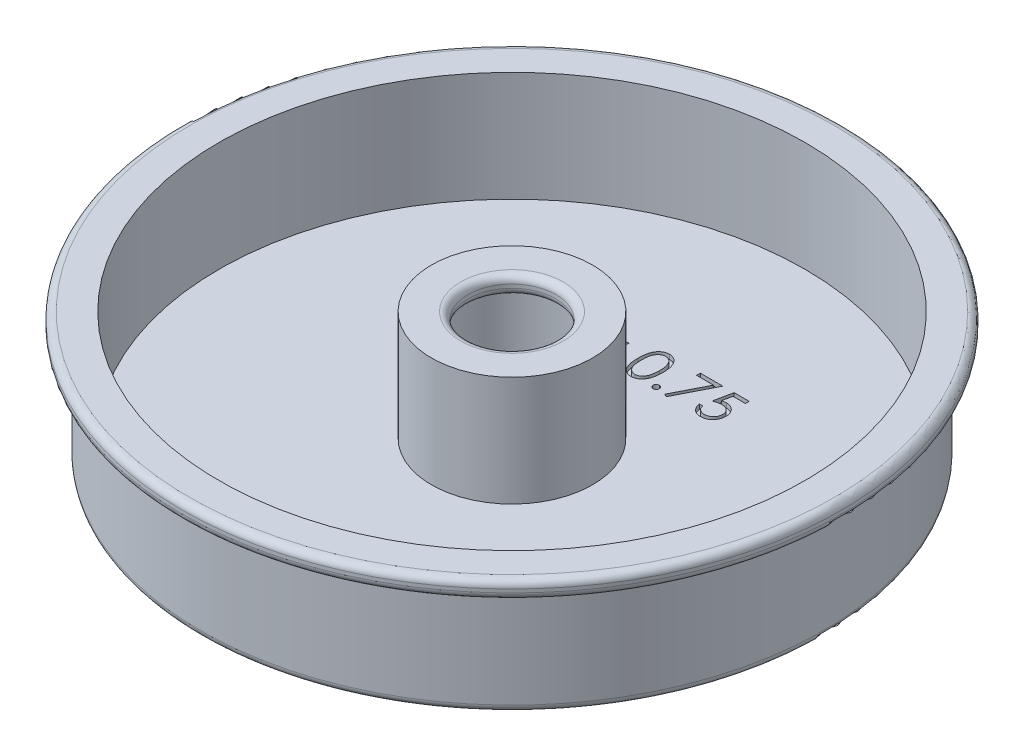
from build123d import *

# Parameters (mm, degrees)
CUT_EXTRUDE1_DEPTH = 0.79375


with BuildPart() as part:
    # Sketch1 → Revolve2 (revolve)
    with BuildSketch(Plane.XY):
        with BuildLine():
            Line((13.97, -3.138174804), (13.97, 15.911825196))
            Line((13.97, 15.911825196), (8.89, 15.911825196))
            ThreePointArc((8.89, 15.911825196), (7.991974388, 15.539850808), (7.62, 14.641825196))
            Line((7.62, 14.641825196), (7.62, 14.006825196))
            ThreePointArc((7.62, 14.006825196), (7.991974388, 13.108799584), (8.89, 12.736825196))
            Line((8.89, 12.736825196), (9.525, 12.736825196))
            ThreePointArc((9.525, 12.736825196), (10.423025612, 12.364850808), (10.795, 11.466825196))
            Line((10.795, 11.466825196), (10.795, -5.043174804))
            ThreePointArc((10.795, -5.043174804), (11.166974388, -5.941200416), (12.065, -6.313174804))
            Line((12.065, -6.313174804), (52.705, -6.313174804))
            ThreePointArc((52.705, -6.313174804), (53.603025612, -5.941200416), (53.975, -5.043174804))
            Line((53.975, -5.043174804), (53.975, 11.503650391))
            ThreePointArc((53.975, 11.503650391), (54.346974388, 12.401676004), (55.245, 12.773650391))
            Line((55.245, 12.773650391), (55.88, 12.773650391))
            ThreePointArc((55.88, 12.773650391), (56.778025612, 13.145624779), (57.15, 14.043650391))
            Line((57.15, 14.043650391), (57.15, 14.641825196))
            ThreePointArc((57.15, 14.641825196), (56.778025612, 15.539850808), (55.88, 15.911825196))
            Line((55.88, 15.911825196), (50.8, 15.911825196))
            Line((50.8, 15.911825196), (50.8, -3.138174804))
            Line((50.8, -3.138174804), (13.97, -3.138174804))
        make_face()
    revolve(axis=Axis((0, 0, 0), (0, 1, 0)))

    # Sketch2 → Cut-Extrude1 (cut)
    # profile 1 of 6: a face of its own
    with BuildSketch(Plane(origin=(0, -3.138174804, 0), x_dir=(1, 0, 0), z_dir=(0, 1, 0))):
        Polygon((-11.649486072, 26.284716058), (-11.533730864, 26.284716058), (-11.533730864, 21.888562212), (-10.801038556, 21.888562212), (-10.801038556, 21.23728016), (-11.533730864, 21.23728016), (-11.533730864, 19.771895545), (-12.103602659, 19.771895545), (-12.103602659, 21.23728016), (-15.115782146, 21.23728016), align=None)
        Polygon((-12.103602659, 21.888562212), (-12.103602659, 24.646334648), (-13.99639112, 21.888562212), align=None, mode=Mode.SUBTRACT)
    # profile 2 of 6: a face of its own
    with BuildSketch(Plane(origin=(0, -3.138174804, 0), x_dir=(1, 0, 0), z_dir=(0, 1, 0))):
        Polygon((-7.788859069, 24.41228016), (-7.110864277, 24.41228016), (-5.916423172, 22.738281763), (-4.721982066, 24.41228016), (-4.043987274, 24.41228016), (-5.576789758, 22.263812612), (-3.799756505, 19.771895545), (-4.477751297, 19.771895545), (-5.916423172, 21.788071426), (-7.355095047, 19.771895545), (-8.033089838, 19.771895545), (-6.25478455, 22.263812612), align=None)
    # profile 3 of 6: a face of its own
    with BuildSketch(Plane(origin=(0, -3.138174804, 0), x_dir=(1, 0, 0), z_dir=(0, 1, 0))):
        with BuildLine():
            add(Edge.make_bspline(
                [(-1.113218043, 22.944351475), (-1.112622925, 23.046128164), (-1.111466898, 23.243830849), (-1.098606477, 23.531911557), (-1.077242642, 23.802168081), (-1.047964837, 24.054613358), (-1.01233593, 24.28931256), (-0.964773547, 24.505638476), (-0.910684605, 24.704592334), (-0.847996596, 24.886822908), (-0.777261608, 25.054785312), (-0.700273735, 25.21158532), (-0.613977608, 25.356985683), (-0.523305209, 25.493307103), (-0.424586164, 25.618318092), (-0.320629787, 25.733784065), (-0.207378669, 25.837036427), (-0.08868264, 25.931100432), (0.036532946, 26.01355876), (0.164698926, 26.086189585), (0.296697475, 26.148237916), (0.432888978, 26.19702485), (0.572049333, 26.237321672), (0.714665011, 26.264878762), (0.860971486, 26.282217725), (0.95972566, 26.283875379), (1.0098088, 26.284716058)],
                knots=[0, 0, 0, 0, 1.646270934, 3.197905019, 4.663502075, 6.030701355, 7.308322542, 8.50163776, 9.611534131, 10.641858119, 11.616356847, 12.558055219, 13.465016945, 14.349605745, 15.204443733, 16.039544428, 16.859896111, 17.680448484, 18.487036065, 19.28249412, 20.06191084, 20.843045899, 21.620316918, 22.403196591, 23.190181807, 24, 24, 24, 24], degree=3))
            add(Edge.make_bspline(
                [(1.0098088, 26.284716058), (1.06031031, 26.283831022), (1.160741927, 26.282070963), (1.30922375, 26.265154668), (1.454275316, 26.23708563), (1.595278224, 26.197314719), (1.7333907, 26.147973991), (1.867532468, 26.086130222), (1.998536745, 26.01414142), (2.124321695, 25.929552385), (2.246268211, 25.835241684), (2.361380944, 25.728629413), (2.469670371, 25.610792066), (2.572495568, 25.482990398), (2.666939295, 25.342773173), (2.756879665, 25.192579145), (2.837383216, 25.029781719), (2.914916126, 24.857097156), (2.981839659, 24.669747375), (3.042194133, 24.468788452), (3.090960262, 24.251846713), (3.131580798, 24.020060382), (3.163049395, 23.772578234), (3.185968617, 23.509930776), (3.1980755, 23.23194521), (3.200355515, 23.041884541), (3.201525546, 22.944351475)],
                knots=[0, 0, 0, 0, 0.810914788, 1.612654377, 2.396697861, 3.181598691, 3.963628158, 4.749916497, 5.551656086, 6.361998678, 7.18212741, 8.025565596, 8.878627764, 9.750805457, 10.657531673, 11.591944965, 12.560506719, 13.57287815, 14.630710178, 15.753379473, 16.941251878, 18.199788006, 19.531962791, 20.947069417, 22.433333509, 24, 24, 24, 24], degree=3))
            add(Edge.make_bspline(
                [(3.201525546, 22.944351475), (3.200343386, 22.847243813), (3.198039994, 22.658033495), (3.18610434, 22.381298725), (3.162593681, 22.120045132), (3.133184131, 21.87364615), (3.092451669, 21.643127328), (3.042368011, 21.427690971), (2.986759568, 21.226406727), (2.918116441, 21.040923569), (2.842985581, 20.868654014), (2.761242582, 20.707786474), (2.673667327, 20.556899057), (2.578256318, 20.417199516), (2.476559411, 20.287698238), (2.366399994, 20.170681123), (2.250883361, 20.063328618), (2.128577978, 19.967803523), (2.000831307, 19.88419252), (1.870276981, 19.80941882), (1.734598557, 19.749125216), (1.596870772, 19.697354499), (1.455123593, 19.65780225), (1.309533713, 19.63045397), (1.160841685, 19.611273616), (1.060327417, 19.609810431), (1.0098088, 19.609075032)],
                knots=[0, 0, 0, 0, 1.561518951, 3.042555995, 4.452378317, 5.7783523, 7.031515105, 8.214008947, 9.334062868, 10.386615937, 11.391082383, 12.354592575, 13.286541444, 14.194233754, 15.072674879, 15.931287219, 16.775624067, 17.606195743, 18.42308326, 19.229000347, 20.022332153, 20.807536673, 21.593273796, 22.3848459, 23.188221202, 24, 24, 24, 24], degree=3))
            add(Edge.make_bspline(
                [(1.0098088, 19.609075032), (0.95972705, 19.609921134), (0.860975615, 19.611589482), (0.714649072, 19.628850109), (0.572622353, 19.656600522), (0.434194613, 19.695456361), (0.29865565, 19.743017564), (0.167852387, 19.804982105), (0.040330447, 19.876345344), (-0.083569948, 19.957617037), (-0.201520583, 20.050729234), (-0.314185195, 20.153715872), (-0.418733444, 20.269146918), (-0.516041018, 20.395199721), (-0.608522578, 20.530714604), (-0.693593298, 20.677541795), (-0.772280419, 20.835099103), (-0.844205037, 21.004404455), (-0.907974756, 21.187928395), (-0.964304169, 21.387770476), (-1.008779854, 21.605694559), (-1.046848931, 21.839950354), (-1.077554597, 22.091544484), (-1.098517444, 22.360613539), (-1.11147383, 22.646989847), (-1.112626029, 22.843422152), (-1.113218043, 22.944351475)],
                knots=[0, 0, 0, 0, 0.810891512, 1.598919785, 2.382837074, 3.152667961, 3.926044502, 4.706494248, 5.493654104, 6.291793342, 7.103789334, 7.925228297, 8.761435821, 9.622817696, 10.50288917, 11.416980706, 12.369136599, 13.353924996, 14.394355917, 15.514179734, 16.714354668, 17.994756427, 19.357759367, 20.818452758, 22.365282078, 24, 24, 24, 24], degree=3))
        make_face()
        with BuildLine():
            add(Edge.make_bspline(
                [(-0.543346249, 22.946895545), (-0.543129537, 22.862080049), (-0.542708944, 22.697469825), (-0.531721266, 22.45826848), (-0.516752988, 22.235165169), (-0.497446634, 22.02787661), (-0.46877557, 21.837104444), (-0.436650398, 21.661536591), (-0.397556007, 21.502102175), (-0.35130076, 21.357707147), (-0.298615542, 21.22590098), (-0.241092046, 21.103253061), (-0.179296163, 20.988314547), (-0.110137133, 20.882117858), (-0.034816947, 20.784316675), (0.044963109, 20.693179965), (0.132180512, 20.611905441), (0.252837302, 20.514429576), (0.412125191, 20.413702005), (0.612822303, 20.325988384), (0.81904935, 20.270865928), (0.959023761, 20.26385597), (1.028889328, 20.260357084)],
                knots=[0, 0, 0, 0, 1.459021318, 2.831673884, 4.118529203, 5.306027144, 6.411944654, 7.436330062, 8.375795394, 9.233974572, 10.042671642, 10.816086306, 11.563610507, 12.285937304, 12.993564865, 13.685989202, 14.367179055, 15.041617293, 16.353048772, 17.594441528, 18.799311195, 20, 20, 20, 20], degree=3))
            add(Edge.make_bspline(
                [(1.028889328, 20.260357084), (1.099206818, 20.263255914), (1.239696619, 20.269047591), (1.444953647, 20.3249253), (1.644217137, 20.409234322), (1.800376229, 20.508924796), (1.919180272, 20.603863337), (2.004301097, 20.684807056), (2.082427956, 20.775441272), (2.156527149, 20.873229995), (2.224488615, 20.980041502), (2.286288879, 21.095362174), (2.342682953, 21.219512254), (2.374812222, 21.306180209), (2.391239088, 21.350491298)],
                knots=[0, 0, 0, 0, 1.353760809, 2.704726607, 4.075137775, 5.516104923, 6.260822281, 7.007110065, 7.778089737, 8.566572457, 9.372053459, 10.217411131, 11.088608312, 12, 12, 12, 12], degree=3))
            add(Edge.make_bspline(
                [(2.391239088, 21.350491298), (2.41038301, 21.407150968), (2.44925338, 21.522194398), (2.499349028, 21.700654167), (2.538801395, 21.887893467), (2.57429493, 22.082793322), (2.598521189, 22.286791065), (2.618020793, 22.499255504), (2.629506468, 22.720346833), (2.63093023, 22.870560603), (2.631653751, 22.946895545)],
                knots=[0, 0, 0, 0, 0.884706709, 1.796334032, 2.740027952, 3.714592787, 4.726048262, 5.777819803, 6.87074269, 8, 8, 8, 8], degree=3))
            add(Edge.make_bspline(
                [(2.631653751, 22.946895545), (2.630655551, 23.023218141), (2.628702857, 23.172521454), (2.621238908, 23.391175868), (2.601964709, 23.598853091), (2.580557736, 23.796447806), (2.548994206, 23.982866212), (2.514962185, 24.159668909), (2.469239986, 24.324665539), (2.420399823, 24.480439352), (2.364500962, 24.625220539), (2.30296813, 24.759684123), (2.237251511, 24.884479267), (2.165873446, 24.999263575), (2.089681278, 25.104551189), (2.00666401, 25.198231096), (1.920114648, 25.283206738), (1.798889182, 25.380203113), (1.640185828, 25.479102904), (1.442708725, 25.570117925), (1.237203413, 25.622384399), (1.098277289, 25.62975346), (1.028889328, 25.633434007)],
                knots=[0, 0, 0, 0, 1.31362396, 2.569729283, 3.763502607, 4.902122613, 5.988968491, 7.01645872, 7.998833611, 8.933434873, 9.825090667, 10.667526885, 11.477055099, 12.250526234, 12.991942729, 13.710640831, 14.402115721, 15.076753259, 16.378508321, 17.609869233, 18.806226677, 20, 20, 20, 20], degree=3))
            add(Edge.make_bspline(
                [(1.028889328, 25.633434007), (0.958657254, 25.629748382), (0.81806516, 25.622370418), (0.61042387, 25.570312658), (0.411388832, 25.479574849), (0.25310515, 25.379875544), (0.131795137, 25.284918894), (0.046373679, 25.202574898), (-0.03372009, 25.112502408), (-0.107502918, 25.013801791), (-0.17660776, 24.907728911), (-0.240073312, 24.793449295), (-0.297254753, 24.67038382), (-0.350022411, 24.538636858), (-0.396418755, 24.394254288), (-0.434689231, 24.235016256), (-0.470044313, 24.060006824), (-0.495072873, 23.868201431), (-0.517322829, 23.660860953), (-0.531621846, 23.437200675), (-0.542745699, 23.197598157), (-0.543142056, 23.032136826), (-0.543346249, 22.946895545)],
                knots=[0, 0, 0, 0, 1.207732386, 2.417664972, 3.655092373, 4.956220595, 5.625982001, 6.301752483, 6.994047911, 7.697131622, 8.419323945, 9.170223765, 9.943494443, 10.752040957, 11.610060368, 12.549350801, 13.567764191, 14.679664412, 15.874934091, 17.154273443, 18.533957287, 20, 20, 20, 20], degree=3))
        make_face(mode=Mode.SUBTRACT)
    # profile 4 of 6: a face of its own
    with BuildSketch(Plane(origin=(0, -3.138174804, 0), x_dir=(1, 0, 0), z_dir=(0, 1, 0))):
        with BuildLine():
            add(Edge.make_bspline(
                [(4.789025546, 20.748818622), (4.82438636, 20.746717377), (4.893707101, 20.742598131), (4.993926662, 20.714337594), (5.084631259, 20.664156882), (5.165425475, 20.59727727), (5.232021511, 20.516186566), (5.283990549, 20.426205418), (5.312004908, 20.325146814), (5.316094148, 20.255424404), (5.318192213, 20.219651955)],
                knots=[0, 0, 0, 0, 1.020151414, 1.999887582, 2.974338812, 3.990962822, 5.007586832, 5.987933904, 6.967670073, 8, 8, 8, 8], degree=3))
            add(Edge.make_bspline(
                [(5.318192213, 20.219651955), (5.316023052, 20.184739057), (5.311745497, 20.115891334), (5.284054765, 20.015594966), (5.231625446, 19.925557583), (5.165884816, 19.843366561), (5.084611286, 19.776345267), (4.993712222, 19.726591484), (4.893942368, 19.696307463), (4.82442561, 19.692449753), (4.789025546, 19.690485289)],
                knots=[0, 0, 0, 0, 1.009421747, 1.99056486, 2.972319754, 3.999869655, 5.017953583, 5.993804169, 6.978383603, 8, 8, 8, 8], degree=3))
            add(Edge.make_bspline(
                [(4.789025546, 19.690485289), (4.753599975, 19.692378672), (4.684439979, 19.696075053), (4.585042532, 19.727213287), (4.493589889, 19.775878708), (4.412332184, 19.843491529), (4.346040957, 19.925134646), (4.295920619, 20.016215048), (4.265821349, 20.115604228), (4.261862809, 20.184682508), (4.25985888, 20.219651955)],
                knots=[0, 0, 0, 0, 1.022052826, 1.995314843, 2.982371812, 4.00089066, 5.028879526, 6.005146991, 6.990147033, 8, 8, 8, 8], degree=3))
            add(Edge.make_bspline(
                [(4.25985888, 20.219651955), (4.261785831, 20.255482973), (4.265547967, 20.325438637), (4.295983808, 20.425585589), (4.345652078, 20.516605471), (4.412790438, 20.597153553), (4.493570232, 20.664621945), (4.584821918, 20.713725212), (4.68467937, 20.742827103), (4.753640258, 20.746786812), (4.789025546, 20.748818622)],
                knots=[0, 0, 0, 0, 1.032775665, 2.016367738, 2.991239715, 4.008302682, 5.025365648, 6.011011707, 6.979408107, 8, 8, 8, 8], degree=3))
        make_face()
    # profile 5 of 6: a face of its own
    with BuildSketch(Plane(origin=(0, -3.138174804, 0), x_dir=(1, 0, 0), z_dir=(0, 1, 0))):
        Polygon((6.539346059, 26.121895545), (10.447038367, 26.121895545), (7.109217854, 19.609075032), (6.61694021, 19.880018542), (9.482835642, 25.470613494), (6.539346059, 25.470613494), align=None)
    # profile 6 of 6: a face of its own
    with BuildSketch(Plane(origin=(0, -3.138174804, 0), x_dir=(1, 0, 0), z_dir=(0, 1, 0))):
        with BuildLine():
            Line((15.006012726, 26.121895545), (15.006012726, 25.470613494))
            Line((15.006012726, 25.470613494), (12.84609686, 25.470613494))
            Line((12.84609686, 25.470613494), (12.503919376, 23.800431202))
            add(Edge.make_bspline(
                [(12.503919376, 23.800431202), (12.57114932, 23.818991838), (12.701396702, 23.854950135), (12.893638164, 23.89487489), (13.076141162, 23.918942195), (13.194569334, 23.92222843), (13.251876107, 23.923818622)],
                knots=[0, 0, 0, 0, 1.100273476, 2.13160584, 3.095893838, 4, 4, 4, 4], degree=3))
            add(Edge.make_bspline(
                [(13.251876107, 23.923818622), (13.322785178, 23.922283853), (13.462210127, 23.919266114), (13.666206503, 23.890288615), (13.860939037, 23.844677627), (14.04600048, 23.780958966), (14.221733194, 23.699479879), (14.386520341, 23.597698559), (14.542835412, 23.478802372), (14.687874118, 23.342104993), (14.819453934, 23.191661489), (14.935143658, 23.029903637), (15.033410072, 22.85840345), (15.112441727, 22.675522345), (15.175550448, 22.483282167), (15.217554782, 22.279660196), (15.245525096, 22.06657575), (15.248649997, 21.920880315), (15.250243495, 21.846585048)],
                knots=[0, 0, 0, 0, 1.052922333, 2.070308379, 3.05430497, 4.020497103, 4.973039431, 5.925935799, 6.892292201, 7.88610001, 8.88166317, 9.857072816, 10.836096531, 11.812156883, 12.81219415, 13.836441305, 14.89672472, 16, 16, 16, 16], degree=3))
            add(Edge.make_bspline(
                [(15.250243495, 21.846585048), (15.249036858, 21.794837591), (15.246639892, 21.692042), (15.234450454, 21.539380378), (15.21098137, 21.389950667), (15.179471356, 21.243733042), (15.138572969, 21.101004324), (15.089062828, 20.96135598), (15.028472893, 20.825657194), (14.962013112, 20.692623977), (14.887180216, 20.565263828), (14.804124924, 20.44615781), (14.716376104, 20.333519185), (14.621958162, 20.228555983), (14.5199935, 20.131957937), (14.411716988, 20.043151769), (14.297992627, 19.960635641), (14.177060973, 19.887759058), (14.051616754, 19.820697695), (13.919848417, 19.765682134), (13.784755432, 19.716495891), (13.644393443, 19.677290033), (13.499080383, 19.646569542), (13.348576719, 19.625704166), (13.193671789, 19.610506915), (13.08866998, 19.609555582), (13.035630114, 19.609075032)],
                knots=[0, 0, 0, 0, 1.056347294, 2.098418968, 3.122841568, 4.141288669, 5.149314143, 6.15115421, 7.162517403, 8.180376062, 9.185164535, 10.17417709, 11.141909838, 12.097768115, 13.052685741, 14.0056014, 14.954263652, 15.917497458, 16.885230207, 17.854509472, 18.828990115, 19.81800267, 20.826176721, 21.857883937, 22.917946725, 24, 24, 24, 24], degree=3))
            add(Edge.make_bspline(
                [(13.035630114, 19.609075032), (12.972358386, 19.61032841), (12.847878736, 19.612794282), (12.665505707, 19.638590677), (12.490037779, 19.675536639), (12.322887453, 19.731119586), (12.162556732, 19.800765106), (12.011204087, 19.888787303), (11.864962179, 19.988535106), (11.729776055, 20.106246603), (11.604307106, 20.234907912), (11.491991011, 20.374531061), (11.391962951, 20.52281162), (11.305824753, 20.6804697), (11.232349771, 20.847091034), (11.174628292, 21.023299907), (11.12804042, 21.208175629), (11.108331071, 21.335454141), (11.098320418, 21.400100673)],
                knots=[0, 0, 0, 0, 1.0467383, 2.05933395, 3.04377827, 4.011590433, 4.970194871, 5.932262533, 6.905835911, 7.896367577, 8.894135286, 9.877477877, 10.858688626, 11.851381753, 12.8477658, 13.868841284, 14.917554742, 16, 16, 16, 16], degree=3))
            Line((11.098320418, 21.400100673), (11.668192213, 21.400100673))
            add(Edge.make_bspline(
                [(11.668192213, 21.400100673), (11.682214024, 21.339546252), (11.709164724, 21.223157293), (11.768320868, 21.059633288), (11.840648957, 20.913911268), (11.926653989, 20.784063596), (12.029251901, 20.670835843), (12.146326722, 20.569930602), (12.277586163, 20.478898582), (12.423442451, 20.403020133), (12.577317609, 20.338306823), (12.73836669, 20.295214462), (12.902204576, 20.264914271), (13.01301819, 20.261881219), (13.06870303, 20.260357084)],
                knots=[0, 0, 0, 0, 1.136247022, 2.183929868, 3.172523383, 4.106158343, 5.02341133, 5.958108904, 6.928429099, 7.938127109, 8.96079061, 9.975095812, 10.982467395, 12, 12, 12, 12], degree=3))
            add(Edge.make_bspline(
                [(13.06870303, 20.260357084), (13.123056208, 20.261846209), (13.23007806, 20.26477831), (13.387578718, 20.287346232), (13.539639219, 20.32210354), (13.684759137, 20.374118848), (13.825477931, 20.437337123), (13.958236057, 20.518463046), (14.086874134, 20.611826222), (14.207393748, 20.718790394), (14.317773891, 20.836663983), (14.415302854, 20.962715825), (14.496540968, 21.097184961), (14.565001423, 21.237743395), (14.616986694, 21.385931635), (14.654072474, 21.541055196), (14.675849452, 21.703497231), (14.678845164, 21.814294407), (14.6803717, 21.870753718)],
                knots=[0, 0, 0, 0, 1.027316725, 2.022795036, 3.002884548, 3.971462791, 4.93288096, 5.914575861, 6.907176829, 7.935150275, 8.956128384, 9.956726525, 10.942570165, 11.921478529, 12.907843606, 13.90538589, 14.932640048, 16, 16, 16, 16], degree=3))
            add(Edge.make_bspline(
                [(14.6803717, 21.870753718), (14.67917703, 21.921691153), (14.676838634, 22.021393935), (14.657733171, 22.167261066), (14.624500949, 22.3052793), (14.578374767, 22.436115125), (14.519810517, 22.559891942), (14.448243637, 22.676737494), (14.362331043, 22.785111734), (14.264192902, 22.885065367), (14.156681885, 22.977312497), (14.037948238, 23.055951054), (13.910476657, 23.122107019), (13.775802955, 23.179198959), (13.630723781, 23.220203168), (13.478112177, 23.25098776), (13.31632015, 23.268795633), (13.205701901, 23.271266487), (13.148841251, 23.272536571)],
                knots=[0, 0, 0, 0, 1.045622112, 2.046656509, 3.013763289, 3.955457236, 4.890082067, 5.820317437, 6.762574623, 7.722996705, 8.69280354, 9.665887285, 10.63943826, 11.638615906, 12.663482002, 13.728887084, 14.832589034, 16, 16, 16, 16], degree=3))
            add(Edge.make_bspline(
                [(13.148841251, 23.272536571), (13.099621623, 23.271483212), (12.997995579, 23.269308295), (12.842107022, 23.253294508), (12.678292039, 23.227460359), (12.507178597, 23.19192531), (12.328252818, 23.145423214), (12.141892291, 23.089698334), (11.947705178, 23.023074137), (11.816863021, 22.972759977), (11.749602469, 22.946895545)],
                knots=[0, 0, 0, 0, 0.817624296, 1.688186739, 2.600797293, 3.572016777, 4.590301741, 5.671205678, 6.80286297, 8, 8, 8, 8], degree=3))
            Line((11.749602469, 22.946895545), (12.400884521, 26.121895545))
            Line((12.400884521, 26.121895545), (15.006012726, 26.121895545))
        make_face()
    extrude(amount=-CUT_EXTRUDE1_DEPTH, mode=Mode.SUBTRACT)


solid = part.part
